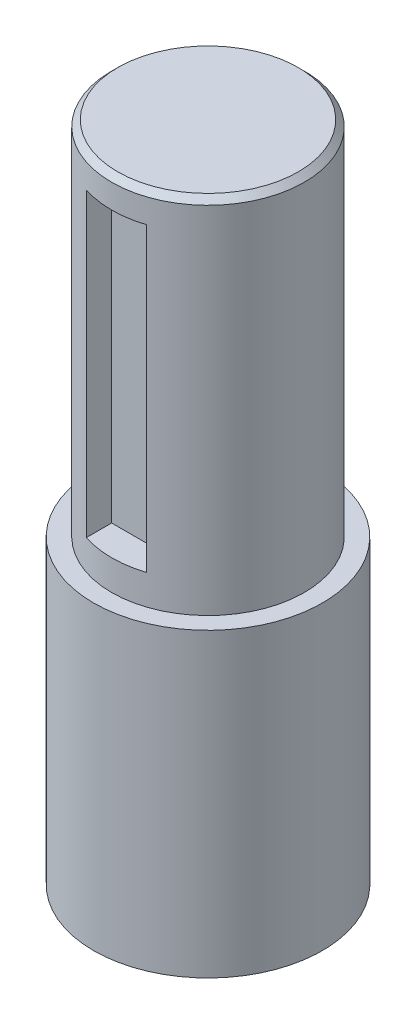
from build123d import *

# Parameters (mm, degrees)
SKETCH1_R           = 16
BOSS_EXTRUDE1_DEPTH = 60
CUT_EXTRUDE1_START  = 16
SKETCH2_W           = 10
SKETCH2_H           = 50
CUT_EXTRUDE1_DEPTH  = 5
SKETCH3_R           = 19
BOSS_EXTRUDE2_DEPTH = 50
CHAMFER1_SIZE       = 1


with BuildPart() as part:
    # Sketch1 → Boss-Extrude1 (new body)
    with BuildSketch(Plane(origin=(0, 0, 0), x_dir=(1, 0, 0), z_dir=(0, 1, 0))):
        Circle(SKETCH1_R)
    extrude(amount=BOSS_EXTRUDE1_DEPTH)

    # Sketch2 → Cut-Extrude1 (cut)
    with BuildSketch(Plane.XY.offset(CUT_EXTRUDE1_START)):
        with Locations((0, 30)):
            Rectangle(SKETCH2_W, SKETCH2_H)
    extrude(amount=-CUT_EXTRUDE1_DEPTH, mode=Mode.SUBTRACT)

    # Sketch3 → Boss-Extrude2 (add)
    with BuildSketch(Plane.XZ):
        Circle(SKETCH3_R)
    extrude(amount=BOSS_EXTRUDE2_DEPTH)

    # Chamfer1
    chamfer1_edges = [part.edges().sort_by_distance(p)[0] for p in [
        (-16, 60, 0),
    ]]
    chamfer(chamfer1_edges, length=CHAMFER1_SIZE)


solid = part.part
